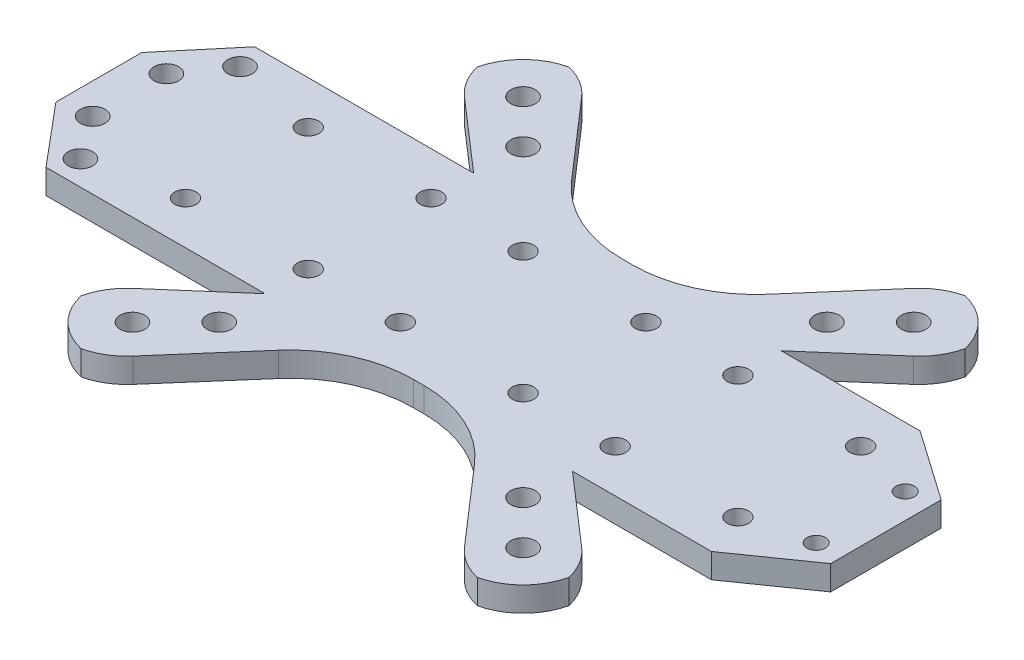
from build123d import *

# Parameters (mm, degrees)
SKETCH1_W           = 80
SKETCH1_H           = 80
SKETCH1_R           = 2
SKETCH1_R_2         = 1.75
BOSS_EXTRUDE1_DEPTH = 4
CUT_EXTRUDE2_DEPTH  = 57.709787515
FILLET1_R           = 10
FILLET2_R           = 20
BOSS_EXTRUDE3_DEPTH = 4
SKETCH6_R           = 1.75
CUT_EXTRUDE3_DEPTH  = 4
SKETCH7_R           = 1.5
CUT_EXTRUDE4_DEPTH  = 10
CHAMFER1_SIZE       = 8
CHAMFER1_SIZE2      = 11.425184054
SKETCH8_W           = 10
SKETCH8_H           = 34
BOSS_EXTRUDE4_DEPTH = 4
SKETCH9_R           = 2
CUT_EXTRUDE5_DEPTH  = 4
CHAMFER2_SIZE       = 10
CHAMFER2_SIZE2      = 8.390996312


with BuildPart() as part:
    # Sketch1 → Boss-Extrude1 (new body)
    with BuildSketch(Plane(origin=(0, 0, 0), x_dir=(1, 0, 0), z_dir=(0, 1, 0))):
        Rectangle(SKETCH1_W, SKETCH1_H)
        with Locations(Location((-24.748737342, 24.748737342, 0), (0, 0, 270))):
            Circle(SKETCH1_R, mode=Mode.SUBTRACT)
        with Locations(Location((24.748737342, 24.748737342, 0), (0, 0, 270))):
            Circle(SKETCH1_R, mode=Mode.SUBTRACT)
        with Locations(Location((24.748737342, -24.748737342, 0), (0, 0, 270))):
            Circle(SKETCH1_R, mode=Mode.SUBTRACT)
        with Locations(Location((-24.748737342, -24.748737342, 0), (0, 0, 270))):
            Circle(SKETCH1_R, mode=Mode.SUBTRACT)
        with Locations(Location((-10, 10, 0), (0, 0, 270))):
            Circle(SKETCH1_R_2, mode=Mode.SUBTRACT)
        with Locations(Location((10, 10, 0), (0, 0, 270))):
            Circle(SKETCH1_R_2, mode=Mode.SUBTRACT)
        with Locations(Location((10, -10, 0), (0, 0, 270))):
            Circle(SKETCH1_R_2, mode=Mode.SUBTRACT)
        with Locations(Location((-10, -10, 0), (0, 0, 270))):
            Circle(SKETCH1_R_2, mode=Mode.SUBTRACT)
        with Locations(Location((31.819805153, 31.819805153, 0), (0, 0, 270))):
            Circle(SKETCH1_R, mode=Mode.SUBTRACT)
        with Locations(Location((-31.819805153, 31.819805153, 0), (0, 0, 270))):
            Circle(SKETCH1_R, mode=Mode.SUBTRACT)
        with Locations(Location((-31.819805153, -31.819805153, 0), (0, 0, 270))):
            Circle(SKETCH1_R, mode=Mode.SUBTRACT)
        with Locations(Location((31.819805153, -31.819805153, 0), (0, 0, 270))):
            Circle(SKETCH1_R, mode=Mode.SUBTRACT)
    extrude(amount=BOSS_EXTRUDE1_DEPTH)

    # Sketch2 → Cut-Extrude2 (cut, through all)
    with BuildSketch(Plane(origin=(0, 4, 0), x_dir=(1, 0, 0), z_dir=(0, 1, 0))):
        Polygon((-40, 30), (-40, -30), (-17, -10), (-17, 10), align=None)
        Polygon((30, 40), (-30, 40), (-10, 17), (10, 17), align=None)
        Polygon((40, -30), (40, 30), (17, 10), (17, -10), align=None)
        Polygon((-30, -40), (30, -40), (10, -17), (-10, -17), align=None)
    extrude(amount=-CUT_EXTRUDE2_DEPTH, mode=Mode.SUBTRACT)

    # Fillet1
    # the kernel refuses this fillet: 10 mm, written as the material it takes off along each edge
    with BuildSketch(Plane(origin=(-30, 15.390762292, 40), x_dir=(-1, 0, 0), z_dir=(0, -1, 0)), Plane(origin=(-40, 15.390762292, 30), x_dir=(0.754605522163505, 0, -0.6561787149247863), z_dir=(0, -1, 0)), Plane(origin=(-40, 15.390762292, -30), x_dir=(0, 0, -1), z_dir=(0, -1, 0)), Plane(origin=(-30, 15.390762292, -40), x_dir=(0.6561787149247871, 0, 0.7546055221635043), z_dir=(0, -1, 0)), Plane(origin=(30, 15.390762292, -40), x_dir=(1, 0, 0), z_dir=(0, -1, 0)), Plane(origin=(40, 15.390762292, -30), x_dir=(-0.7546055221635045, 0, 0.6561787149247867), z_dir=(0, -1, 0)), Plane(origin=(40, 15.390762292, 30), x_dir=(0, 0, 1), z_dir=(0, -1, 0))) as fillet1_piece_1:
        with BuildLine():
            CenterArc((FILLET1_R * 0.455630491663, FILLET1_R), FILLET1_R, 221.009086902, 48.990913098)
            Line((-FILLET1_R * 0.2989750305, FILLET1_R * 0.343821285075), (0, 0))
            Line((0, 0), (FILLET1_R * 0.455630491663, 0))
        make_face()
    extrude(amount=26.781524583, mode=Mode.SUBTRACT)
    with BuildSketch(Plane(origin=(-40, -25, 40), x_dir=(0, 0, -1), z_dir=(0, 1, 0)), Plane(origin=(-40, -25, -40), x_dir=(1, 0, 0), z_dir=(0, 1, 0)), Plane(origin=(40, -25, -40), x_dir=(0, 0, 1), z_dir=(0, 1, 0)), Plane(origin=(40, -25, 40), x_dir=(-1, 0, 0), z_dir=(0, 1, 0))) as fillet1_piece_2:
        with BuildLine():
            CenterArc((FILLET1_R, -FILLET1_R), FILLET1_R, 90, 90)
            Line((0, -FILLET1_R), (0, 0))
            Line((0, 0), (FILLET1_R, 0))
        make_face()
    extrude(amount=54, mode=Mode.SUBTRACT)
    with BuildSketch(Plane(origin=(30, 15.390762292, 40), x_dir=(1, 0, 0), z_dir=(0, -1, 0))) as fillet1_piece_3:
        with BuildLine():
            CenterArc((FILLET1_R * 0.455630491663, -FILLET1_R), FILLET1_R, 90, 48.990913098)
            Line((-FILLET1_R * 0.2989750305, -FILLET1_R * 0.343821285075), (0, 0))
            Line((0, 0), (FILLET1_R * 0.455630491663, 0))
        make_face()
    extrude(amount=26.781524583, mode=Mode.SUBTRACT)

    # Fillet2
    fillet2_edges = [part.edges().sort_by_distance(p)[0] for p in [
        (10, 2, 17),
        (-10, 2, 17),
        (-17, 2, 10),
        (-17, 2, -10),
        (17, 2, -10),
        (17, 2, 10),
        (-10, 2, -17),
        (10, 2, -17),
    ]]
    fillet(fillet2_edges, radius=FILLET2_R)

    # Sketch5 → Boss-Extrude3 (add)
    with BuildSketch(Plane(origin=(0, 4, 0), x_dir=(1, 0, 0), z_dir=(0, 1, 0))):
        Polygon((-0.887390167, 17), (13.289046487, 12.123524967), (13.289046487, -13.496190448), (-0.887390167, -17), (59.112609833, -17), (59.112609833, 17), align=None)
    boss_extrude3 = extrude(amount=-BOSS_EXTRUDE3_DEPTH)

    # Sketch6 → Cut-Extrude3 (cut)
    with BuildSketch(Plane(origin=(0, 4, 0), x_dir=(1, 0, 0), z_dir=(0, 1, 0))):
        with Locations(Location((25, 10, 0), (0, 0, 270))):
            Circle(SKETCH6_R)
        with Locations(Location((45, 10, 0), (0, 0, 270))):
            Circle(SKETCH6_R)
        with Locations(Location((25, -10, 0), (0, 0, 270))):
            Circle(SKETCH6_R)
        with Locations(Location((45, -10, 0), (0, 0, 270))):
            Circle(SKETCH6_R)
    cut_extrude3 = extrude(amount=-CUT_EXTRUDE3_DEPTH, mode=Mode.SUBTRACT)

    # Mirror1: Boss-Extrude3, Cut-Extrude3 across plane
    add(boss_extrude3.mirror(Plane(origin=(0, 0, 0), x_dir=(0, 0, 1), z_dir=(1, 0, 0))))
    add(cut_extrude3.mirror(Plane(origin=(0, 0, 0), x_dir=(0, 0, 1), z_dir=(1, 0, 0))), mode=Mode.SUBTRACT)

    # Sketch7 → Cut-Extrude4 (cut)
    with BuildSketch(Plane(origin=(0, 4, 0), x_dir=(1, 0, 0), z_dir=(0, 1, 0))):
        with Locations(Location((55, 7.25, 0), (0, 0, 270))):
            Circle(SKETCH7_R)
        with Locations(Location((55, -7.25, 0), (0, 0, 270))):
            Circle(SKETCH7_R)
    extrude(amount=-CUT_EXTRUDE4_DEPTH, mode=Mode.SUBTRACT)

    # Chamfer1
    chamfer1_edges = [part.edges().sort_by_distance(p)[0] for p in [
        (59.112609833, 2, 17),
        (59.112609833, 2, -17),
    ]]
    chamfer1_side = [part.faces().sort_by_distance(p)[0] for p in [
        (59.112609833, 2, 0),
    ]]
    chamfer(chamfer1_edges, length=CHAMFER1_SIZE, length2=CHAMFER1_SIZE2, reference=chamfer1_side[0])

    # Sketch8 → Boss-Extrude4 (add)
    with BuildSketch(Plane(origin=(0, 4, 0), x_dir=(1, 0, 0), z_dir=(0, 1, 0))):
        with Locations((-64.112609833, 0)):
            Rectangle(SKETCH8_W, SKETCH8_H)
    extrude(amount=-BOSS_EXTRUDE4_DEPTH)

    # Sketch9 → Cut-Extrude5 (cut)
    with BuildSketch(Plane(origin=(0, 4, 0), x_dir=(1, 0, 0), z_dir=(0, 1, 0))):
        with Locations(Location((-64.112609833, 6, 0), (0, 0, 270))):
            Circle(SKETCH9_R)
        with Locations(Location((-64.112609833, -6, 0), (0, 0, 270))):
            Circle(SKETCH9_R)
        with Locations(Location((-59.112609833, -13, 0), (0, 0, 270))):
            Circle(SKETCH9_R)
        with Locations(Location((-59.112609833, 13, 0), (0, 0, 270))):
            Circle(SKETCH9_R)
    extrude(amount=-CUT_EXTRUDE5_DEPTH, mode=Mode.SUBTRACT)

    # Chamfer2
    chamfer2_edges = [part.edges().sort_by_distance(p)[0] for p in [
        (-69.112609833, 2, 17),
        (-69.112609833, 2, -17),
    ]]
    chamfer2_side = [part.faces().sort_by_distance(p)[0] for p in [
        (-69.112609833, 2, 0),
    ]]
    chamfer(chamfer2_edges, length=CHAMFER2_SIZE, length2=CHAMFER2_SIZE2, reference=chamfer2_side[0])


solid = part.part
